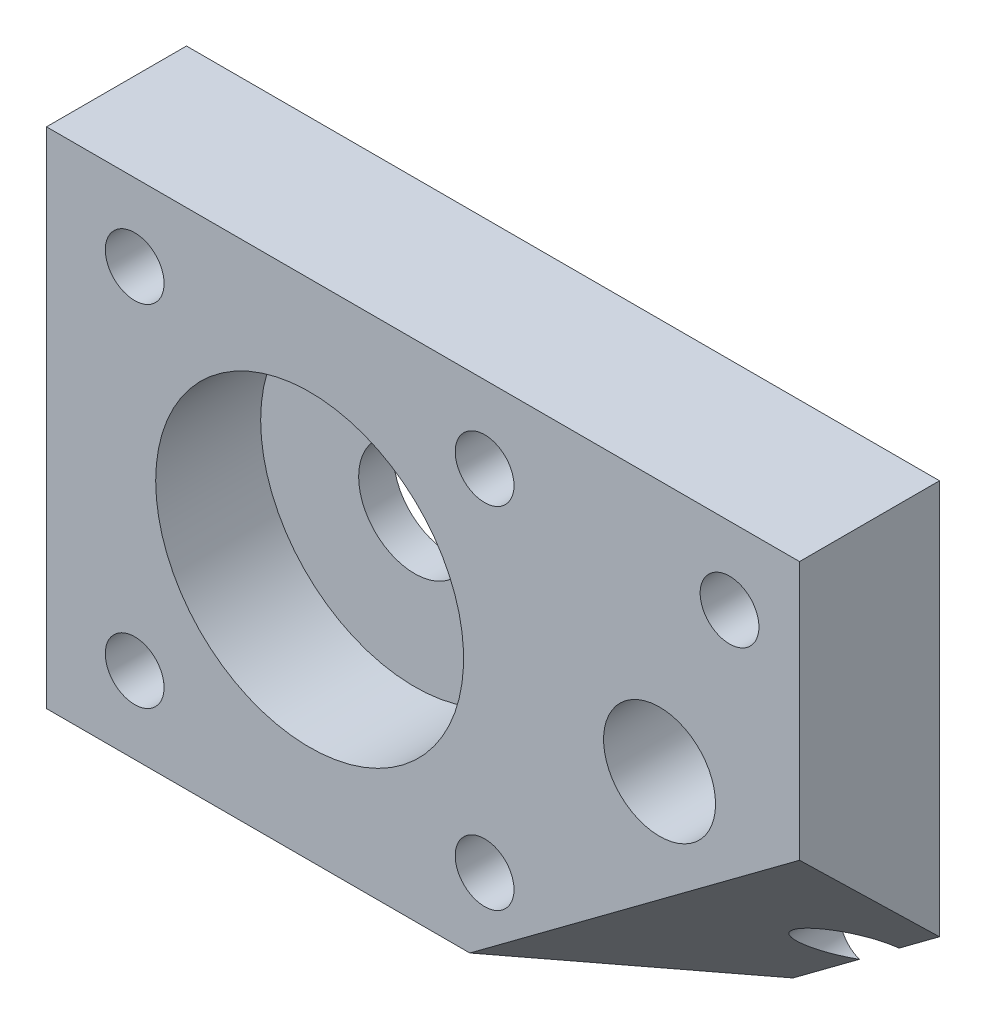
from build123d import *

# Parameters (mm, degrees)
JOTYY_MIRRORED_START         = -10
JOTYY_MIRRORED_OUTLINE_W     = 53.8
JOTYY_MIRRORED_OUTLINE_H     = 36
JOTYY_MIRRORED_OUTLINE_R     = 2.1
JOTYY_MIRRORED_OUTLINE_R_2   = 11
JOTYY_MIRRORED_DEPTH         = 10
JOTYY_MIRRORED_2_OUTLINE_R   = 11
JOTYY_MIRRORED_2_OUTLINE_R_2 = 4
JOTYY_MIRRORED_2_DEPTH       = 2.5
SKETCH1_R                    = 4
CUT_EXTRUDE1_DEPTH           = 10
CUT_EXTRUDE2_DEPTH           = 58.211226571


# Read off the part's stored shape, not the designer's step: jotyy_Mirrored
with BuildPart() as part:
    # jotyy_Mirrored outline → jotyy_Mirrored (new body)
    with BuildSketch(Plane.XY.offset(JOTYY_MIRRORED_START)):
        with Locations((-26.9, 20)):
            Rectangle(JOTYY_MIRRORED_OUTLINE_W, JOTYY_MIRRORED_OUTLINE_H)
        with Locations((-47.5, 7.5)):
            Circle(JOTYY_MIRRORED_OUTLINE_R, mode=Mode.SUBTRACT)
        with Locations((-22.5, 7.5)):
            Circle(JOTYY_MIRRORED_OUTLINE_R, mode=Mode.SUBTRACT)
        with Locations((-5, 7.5)):
            Circle(JOTYY_MIRRORED_OUTLINE_R, mode=Mode.SUBTRACT)
        with Locations((-35, 20)):
            Circle(JOTYY_MIRRORED_OUTLINE_R_2, mode=Mode.SUBTRACT)
        with Locations((-47.5, 32.5)):
            Circle(JOTYY_MIRRORED_OUTLINE_R, mode=Mode.SUBTRACT)
        with Locations((-22.5, 32.5)):
            Circle(JOTYY_MIRRORED_OUTLINE_R, mode=Mode.SUBTRACT)
        with Locations((-5, 32.5)):
            Circle(JOTYY_MIRRORED_OUTLINE_R, mode=Mode.SUBTRACT)
    extrude(amount=JOTYY_MIRRORED_DEPTH)

    # jotyy_Mirrored 2 outline → jotyy_Mirrored 2 (add)
    with BuildSketch(Plane.XY.offset(JOTYY_MIRRORED_START)):
        with Locations((-35, 20)):
            Circle(JOTYY_MIRRORED_2_OUTLINE_R)
        with Locations((-35, 20)):
            Circle(JOTYY_MIRRORED_2_OUTLINE_R_2, mode=Mode.SUBTRACT)
    extrude(amount=JOTYY_MIRRORED_2_DEPTH)

    # Sketch1 → Cut-Extrude1 (cut)
    with BuildSketch(Plane.XY):
        with Locations((-10, 20)):
            Circle(SKETCH1_R)
    extrude(amount=-CUT_EXTRUDE1_DEPTH, mode=Mode.SUBTRACT)

    # Sketch4 → Cut-Extrude2 (cut, through all)
    with BuildSketch(Plane(origin=(-5.803979924, 7.804579549, -7.598887182), x_dir=(-0.8814294563143725, -0.3015166465944173, 0.36355168183878195), z_dir=(-0.47023817530075585, 0.6323266610618664, -0.6156614753256593))):
        Polygon((64.66091517, 41.829227813), (-62.885997207, -203.452641014), (-179.111332111, -143.015305479), (-51.564419733, 102.266563348), align=None)
    extrude(amount=-CUT_EXTRUDE2_DEPTH, mode=Mode.SUBTRACT)


solid = part.part
